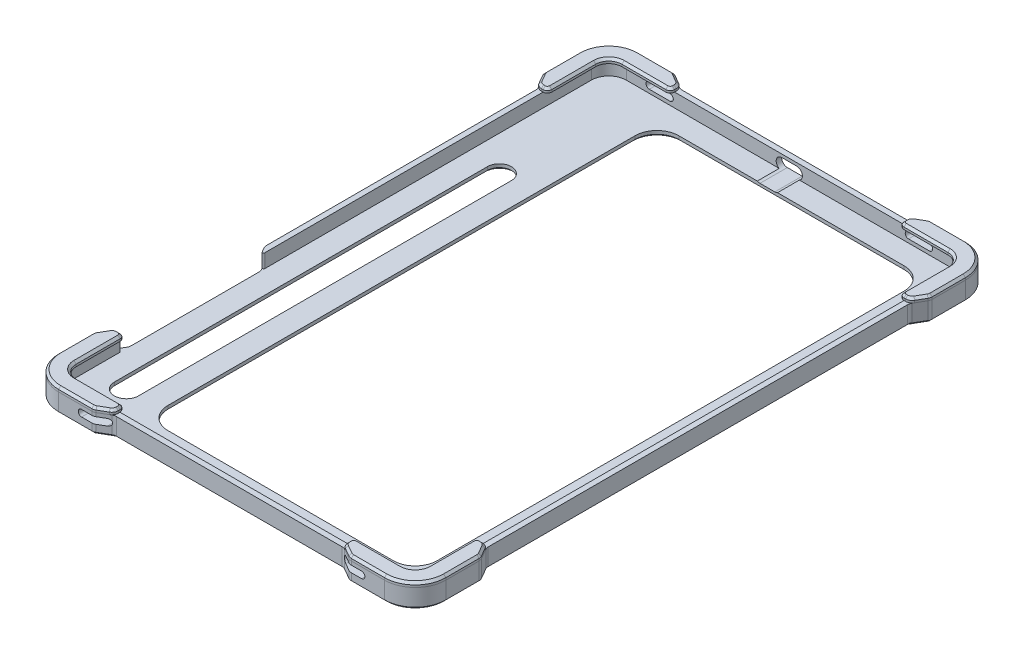
from build123d import *

# Parameters (mm, degrees)
BOSS_EXTRUDE1_DEPTH     = 8.8
SKETCH2_W               = 123
SKETCH2_H               = 233.5
BOSS_EXTRUDE2_DEPTH     = 2.5
FILLET1_R               = 10
CUT_EXTRUDE1_DEPTH      = 2.5
MIRROR2_COPY_1_DEPTH    = 2.5
BOSS_EXTRUDE3_DEPTH     = 2
BOSS_EXTRUDE4_DEPTH     = 2.4
MOVE_START              = 6.4
MOVE_FACE1_DEPTH        = 2.4
FILLET2_R               = 2
FILLET5_R               = 3
CHAMFER2_SIZE           = 1
CHAMFER3_SIZE           = 1
FILLET3_R               = 3
CUT_EXTRUDE2_DEPTH      = 277.754205027
CUT_EXTRUDE2_DEPTH_BACK = 277.754205027
CUT_EXTRUDE4_START      = -12.5
CUT_EXTRUDE4_DEPTH      = 12.5
CUT_EXTRUDE5_DEPTH      = 6.3


# Read off the part's stored shape, not the designer's step: Move Face1
with BuildPart() as part:
    # Sketch1 → Boss-Extrude1 (new body)
    with BuildSketch(Plane(origin=(0, 0, 0), x_dir=(1, 0, 0), z_dir=(0, 1, 0))):
        with BuildLine():
            ThreePointArc((-82.5, 118.75), (-80.156854249, 124.406854249), (-74.5, 126.75))
            Line((-74.5, 126.75), (74.5, 126.75))
            ThreePointArc((74.5, 126.75), (80.156854249, 124.406854249), (82.5, 118.75))
            Line((82.5, 118.75), (82.5, -118.75))
            ThreePointArc((82.5, -118.75), (80.156854249, -124.406854249), (74.5, -126.75))
            Line((74.5, -126.75), (-74.5, -126.75))
            ThreePointArc((-74.5, -126.75), (-80.156854249, -124.406854249), (-82.5, -118.75))
            Line((-82.5, -118.75), (-82.5, -92.357695155))
            Line((-82.5, -92.357695155), (-88.5, -102.75))
            Line((-88.5, -102.75), (-88.5, -118.75))
            ThreePointArc((-88.5, -118.75), (-84.399494937, -128.649494937), (-74.5, -132.75))
            Line((-74.5, -132.75), (-58.5, -132.75))
            Line((-58.5, -132.75), (-52.437822174, -129.25))
            Line((-52.437822174, -129.25), (52.437822174, -129.25))
            Line((52.437822174, -129.25), (58.5, -132.75))
            Line((58.5, -132.75), (74.5, -132.75))
            ThreePointArc((74.5, -132.75), (84.399494937, -128.649494937), (88.5, -118.75))
            Line((88.5, -118.75), (88.5, -102.75))
            Line((88.5, -102.75), (85, -96.687822174))
            Line((85, -96.687822174), (85, 96.687822174))
            Line((85, 96.687822174), (88.5, 102.75))
            Line((88.5, 102.75), (88.5, 118.75))
            ThreePointArc((88.5, 118.75), (84.399494937, 128.649494937), (74.5, 132.75))
            Line((74.5, 132.75), (58.5, 132.75))
            Line((58.5, 132.75), (52.437822174, 129.25))
            Line((52.437822174, 129.25), (-52.437822174, 129.25))
            Line((-52.437822174, 129.25), (-58.5, 132.75))
            Line((-58.5, 132.75), (-74.5, 132.75))
            ThreePointArc((-74.5, 132.75), (-84.399494937, 128.649494937), (-88.5, 118.75))
            Line((-88.5, 118.75), (-88.5, 102.75))
            Line((-88.5, 102.75), (-85, 96.687822174))
            Line((-85, 96.687822174), (-85, -28.027568136))
            Line((-85, -28.027568136), (-82.5, -32.357695155))
            Line((-82.5, -32.357695155), (-82.5, 118.75))
        make_face()
    extrude(amount=BOSS_EXTRUDE1_DEPTH)

    # Sketch2 → Boss-Extrude2 (add)
    with BuildSketch(Plane.XZ):
        with BuildLine():
            Line((-82.5, 118.75), (-82.5, -118.75))
            ThreePointArc((-82.5, -118.75), (-80.156854249, -124.406854249), (-74.5, -126.75))
            Line((-74.5, -126.75), (74.5, -126.75))
            ThreePointArc((74.5, -126.75), (80.156854249, -124.406854249), (82.5, -118.75))
            Line((82.5, -118.75), (82.5, 118.75))
            ThreePointArc((82.5, 118.75), (80.156854249, 124.406854249), (74.5, 126.75))
            Line((74.5, 126.75), (-74.5, 126.75))
            ThreePointArc((-74.5, 126.75), (-80.156854249, 124.406854249), (-82.5, 118.75))
        make_face()
        with BuildLine():
            ThreePointArc((-72, 109.75), (-66.5, 115.25), (-61, 109.75))
            Line((-61, 109.75), (-61, -60.75))
            ThreePointArc((-61, -60.75), (-66.5, -66.25), (-72, -60.75))
            Line((-72, -60.75), (-72, 109.75))
        make_face(mode=Mode.SUBTRACT)
        with Locations((11, 0)):
            Rectangle(SKETCH2_W, SKETCH2_H, mode=Mode.SUBTRACT)
    extrude(amount=-BOSS_EXTRUDE2_DEPTH)

    # Fillet1
    fillet1_edges = [part.edges().sort_by_distance(p)[0] for p in [
        (-50.5, 1.25, -116.75),
        (72.5, 1.25, -116.75),
        (72.5, 1.25, 116.75),
        (-50.5, 1.25, 116.75),
    ]]
    fillet(fillet1_edges, radius=FILLET1_R)

    # Sketch3 → Cut-Extrude1 (cut)
    with BuildSketch(Plane(origin=(0, 8.8, 0), x_dir=(1, 0, 0), z_dir=(0, 1, 0))):
        with BuildLine():
            ThreePointArc((-84, 104.25), (-85.5, 102.75), (-87, 104.25))
            Line((-87, 104.25), (-87, 118.75))
            ThreePointArc((-87, 118.75), (-83.338834765, 127.588834765), (-74.5, 131.25))
            Line((-74.5, 131.25), (-60, 131.25))
            ThreePointArc((-60, 131.25), (-58.5, 129.75), (-60, 128.25))
            Line((-60, 128.25), (-74.5, 128.25))
            ThreePointArc((-74.5, 128.25), (-81.217514421, 125.467514421), (-84, 118.75))
            Line((-84, 118.75), (-84, 104.25))
        make_face()
    cut_extrude1 = extrude(amount=-CUT_EXTRUDE1_DEPTH, mode=Mode.SUBTRACT)

    # Mirror1: Cut-Extrude1 across plane
    add(cut_extrude1.mirror(Plane(origin=(0, 0, 0), x_dir=(0, 0, 1), z_dir=(1, 0, 0))), mode=Mode.SUBTRACT)

    # Mirror2: Cut-Extrude1 across plane
    add(cut_extrude1.mirror(Plane.XY), mode=Mode.SUBTRACT)

    # Mirror2 copy 1 sketch → Mirror2 copy 1 (cut)
    with BuildSketch(Plane(origin=(0, 8.8, 0), x_dir=(-1, 0, 0), z_dir=(0, 1, 0))):
        with BuildLine():
            ThreePointArc((-84, 104.25), (-85.5, 102.75), (-87, 104.25))
            Line((-87, 104.25), (-87, 118.75))
            ThreePointArc((-87, 118.75), (-83.338834765, 127.588834765), (-74.5, 131.25))
            Line((-74.5, 131.25), (-60, 131.25))
            ThreePointArc((-60, 131.25), (-58.5, 129.75), (-60, 128.25))
            Line((-60, 128.25), (-74.5, 128.25))
            ThreePointArc((-74.5, 128.25), (-81.217514421, 125.467514421), (-84, 118.75))
            Line((-84, 118.75), (-84, 104.25))
        make_face()
    extrude(amount=-MIRROR2_COPY_1_DEPTH, mode=Mode.SUBTRACT)

    # Chamfer3
    chamfer3_edges = [part.edges().sort_by_distance(p)[0] for p in [
        (-82.5, 0, 62.357695155),
        (-66.5, 0, -66.25),
        (-66.5, 0, 115.25),
        (-72, 0, 24.5),
        (-61, 0, 24.5),
        (72.5, 0, 0),
        (11, 0, -116.75),
        (11, 0, 116.75),
        (-50.5, 0, 0),
        (69.571067812, 0, -113.821067812),
        (69.571067812, 0, 113.821067812),
        (-47.571067812, 0, -113.821067812),
        (-47.571067812, 0, 113.821067812),
        (55.468911087, 0, -131),
        (66.5, 0, -132.75),
        (84.399494937, 0, -128.649494937),
        (88.5, 0, -110.75),
        (86.75, 0, -99.718911087),
        (85, 0, 0),
        (86.75, 0, 99.718911087),
        (88.5, 0, 110.75),
        (84.399494937, 0, 128.649494937),
        (66.5, 0, 132.75),
        (55.468911087, 0, 131),
        (0, 0, 129.25),
        (-55.468911087, 0, 131),
        (-66.5, 0, 132.75),
        (-84.399494937, 0, 128.649494937),
        (-88.5, 0, 110.75),
        (-85.5, 0, 97.553847577),
        (-83.75, 0, 30.192631645),
        (-85, 0, -34.330127019),
        (-86.75, 0, -99.718911087),
        (-88.5, 0, -110.75),
        (-84.399494937, 0, -128.649494937),
        (-66.5, 0, -132.75),
        (-55.468911087, 0, -131),
        (0, 0, -129.25),
    ]]
    chamfer(chamfer3_edges, length=CHAMFER3_SIZE)

    # Fillet3
    fillet3_edges = [part.edges().sort_by_distance(p)[0] for p in [
        (-82.5, 1.75, 92.357695155),
        (-82.5, 1.75, 32.357695155),
        (52.437822174, 4.9, -129.25),
        (58.5, 4.9, -132.75),
        (88.5, 4.9, -102.75),
        (85, 4.9, -96.687822174),
        (85, 4.9, 96.687822174),
        (88.5, 4.9, 102.75),
        (58.5, 4.9, 132.75),
        (52.437822174, 4.9, 129.25),
        (-52.437822174, 4.9, 129.25),
        (-58.5, 4.9, 132.75),
        (-88.5, 4.9, 102.75),
        (-85, 4.9, 28.027568136),
        (-85, 4.9, -96.687822174),
        (-88.5, 4.9, -102.75),
        (-58.5, 4.9, -132.75),
        (-52.437822174, 4.9, -129.25),
    ]]
    fillet(fillet3_edges, radius=FILLET3_R)


with BuildPart() as body_2:
    # Sketch3<4> → Boss-Extrude3 (new body)
    # profile 1 of 2: a face of its own
    with BuildSketch(Plane(origin=(0, 8.8, 0), x_dir=(1, 0, 0), z_dir=(0, 1, 0))):
        with BuildLine():
            ThreePointArc((-74.5, 132.75), (-84.399494937, 128.649494937), (-88.5, 118.75))
            Line((-88.5, 118.75), (-88.5, 102.75))
            Line((-88.5, 102.75), (-85, 96.687822174))
            Line((-85, 96.687822174), (-80.5, 96.687822174))
            Line((-80.5, 96.687822174), (-80.5, 118.75))
            ThreePointArc((-80.5, 118.75), (-78.742640687, 122.992640687), (-74.5, 124.75))
            Line((-74.5, 124.75), (-52.437822174, 124.75))
            Line((-52.437822174, 124.75), (-52.437822174, 126.75))
            Line((-52.437822174, 126.75), (-52.437822174, 129.25))
            Line((-52.437822174, 129.25), (-58.5, 132.75))
            Line((-58.5, 132.75), (-74.5, 132.75))
        make_face()
        with BuildLine():
            Line((-74.5, 131.25), (-60, 131.25))
            ThreePointArc((-60, 131.25), (-58.5, 129.75), (-60, 128.25))
            Line((-60, 128.25), (-74.5, 128.25))
            ThreePointArc((-74.5, 128.25), (-81.217514421, 125.467514421), (-84, 118.75))
            Line((-84, 118.75), (-84, 104.25))
            ThreePointArc((-84, 104.25), (-85.5, 102.75), (-87, 104.25))
            Line((-87, 104.25), (-87, 118.75))
            ThreePointArc((-87, 118.75), (-83.338834765, 127.588834765), (-74.5, 131.25))
        make_face(mode=Mode.SUBTRACT)
    # profile 2 of 2: a face of its own
    with BuildSketch(Plane(origin=(0, 8.8, 0), x_dir=(1, 0, 0), z_dir=(0, 1, 0))):
        with BuildLine():
            ThreePointArc((-84, 104.25), (-85.5, 102.75), (-87, 104.25))
            Line((-87, 104.25), (-87, 118.75))
            ThreePointArc((-87, 118.75), (-83.338834765, 127.588834765), (-74.5, 131.25))
            Line((-74.5, 131.25), (-60, 131.25))
            ThreePointArc((-60, 131.25), (-58.5, 129.75), (-60, 128.25))
            Line((-60, 128.25), (-74.5, 128.25))
            ThreePointArc((-74.5, 128.25), (-81.217514421, 125.467514421), (-84, 118.75))
            Line((-84, 118.75), (-84, 104.25))
        make_face()
    extrude(amount=BOSS_EXTRUDE3_DEPTH)

    # Sketch3<5> → Boss-Extrude4 (add)
    with BuildSketch(Plane(origin=(0, 8.8, 0), x_dir=(1, 0, 0), z_dir=(0, 1, 0))):
        with BuildLine():
            Line((-60, 131.25), (-74.5, 131.25))
            ThreePointArc((-74.5, 131.25), (-83.338834765, 127.588834765), (-87, 118.75))
            Line((-87, 118.75), (-87, 104.25))
            ThreePointArc((-87, 104.25), (-85.5, 102.75), (-84, 104.25))
            Line((-84, 104.25), (-84, 118.75))
            ThreePointArc((-84, 118.75), (-81.217514421, 125.467514421), (-74.5, 128.25))
            Line((-74.5, 128.25), (-60, 128.25))
            ThreePointArc((-60, 128.25), (-58.5, 129.75), (-60, 131.25))
        make_face()
    extrude(amount=-BOSS_EXTRUDE4_DEPTH)

    # Move Face1 outline → Move Face1 (cut)
    with BuildSketch(Plane(origin=(0, 0, 0), x_dir=(1, 0, 0), z_dir=(0, 1, 0)).offset(MOVE_START)):
        with BuildLine():
            Line((-87, 118.75), (-87, 104.25))
            ThreePointArc((-87, 104.25), (-85.5, 102.75), (-84, 104.25))
            Line((-84, 104.25), (-84, 118.75))
            ThreePointArc((-84, 118.75), (-81.217514421, 125.467514421), (-74.5, 128.25))
            Line((-74.5, 128.25), (-60, 128.25))
            ThreePointArc((-60, 128.25), (-58.5, 129.75), (-60, 131.25))
            Line((-60, 131.25), (-74.5, 131.25))
            ThreePointArc((-74.5, 131.25), (-83.338834765, 127.588834765), (-87, 118.75))
        make_face()
        with BuildLine():
            ThreePointArc((-84.1, 104.25), (-85.5, 102.85), (-86.9, 104.25))
            Line((-86.9, 104.25), (-86.9, 118.75))
            ThreePointArc((-86.9, 118.75), (-83.268124087, 127.518124087), (-74.5, 131.15))
            Line((-74.5, 131.15), (-60, 131.15))
            ThreePointArc((-60, 131.15), (-58.6, 129.75), (-60, 128.35))
            Line((-60, 128.35), (-74.5, 128.35))
            ThreePointArc((-74.5, 128.35), (-81.288225099, 125.538225099), (-84.1, 118.75))
            Line((-84.1, 118.75), (-84.1, 104.25))
        make_face(mode=Mode.SUBTRACT)
    extrude(amount=MOVE_FACE1_DEPTH, mode=Mode.SUBTRACT)

    # Fillet2
    fillet2_edges = [body_2.edges().sort_by_distance(p)[0] for p in [
        (-52.437822174, 9.8, -124.75),
        (-80.5, 9.8, -96.687822174),
    ]]
    fillet(fillet2_edges, radius=FILLET2_R)

    # Fillet5
    fillet5_edges = [body_2.edges().sort_by_distance(p)[0] for p in [
        (-85, 9.8, -96.687822174),
        (-88.5, 9.8, -102.75),
        (-58.5, 9.8, -132.75),
        (-52.437822174, 9.8, -129.25),
    ]]
    fillet(fillet5_edges, radius=FILLET5_R)

    # Chamfer2
    chamfer2_edges = [body_2.edges().sort_by_distance(p)[0] for p in [
        (-84.399494937, 10.8, -128.649494937),
        (-88.5, 10.8, -111.151923789),
        (-78.742640687, 10.8, -122.992640687),
        (-64.468911087, 10.8, -124.75),
        (-80.5, 10.8, -108.718911087),
        (-81.085786438, 10.8, -97.273608611),
        (-53.023608611, 10.8, -125.335786438),
        (-66.901923789, 10.8, -132.75),
        (-55.870834875, 10.8, -131.232050808),
        (-52.437822174, 10.8, -127.133974596),
        (-86.982050808, 10.8, -100.120834875),
        (-82.883974596, 10.8, -96.687822174),
        (-84.767949192, 10.8, -97.089745962),
        (-88.397777479, 10.8, -102.777390442),
        (-52.839745962, 10.8, -129.017949192),
        (-58.527390442, 10.8, -132.647777479),
    ]]
    chamfer(chamfer2_edges, length=CHAMFER2_SIZE)


with BuildPart() as body_3:
    # Mirror3: mirrored copy
    add(body_2.part.mirror(Plane(origin=(0, 0, 0), x_dir=(0, 0, 1), z_dir=(1, 0, 0))))


with BuildPart() as body_4:
    # Mirror4: mirrored copy
    add(body_2.part.mirror(Plane.XY))


with BuildPart() as body_5:
    # Mirror4 2: mirrored copy
    add(body_3.part.mirror(Plane.XY))


with BuildPart() as cut_extrude2_tool:
    # Sketch4 → Cut-Extrude2 (new, two sides: drawn at the far end of the back side and taken through both)
    with BuildSketch(Plane(origin=(0, 0, -129.25), x_dir=(-1, 0, 0), z_dir=(0, 0, -1)).offset(-CUT_EXTRUDE2_DEPTH_BACK)):
        with BuildLine():
            Line((-64, 7.15), (-54.5, 7.15))
            ThreePointArc((-54.5, 7.15), (-53, 5.65), (-54.5, 4.15))
            Line((-54.5, 4.15), (-64, 4.15))
            ThreePointArc((-64, 4.15), (-65.5, 5.65), (-64, 7.15))
        make_face()
        with BuildLine():
            Line((64, 7.15), (54.5, 7.15))
            ThreePointArc((54.5, 7.15), (53, 5.65), (54.5, 4.15))
            Line((54.5, 4.15), (64, 4.15))
            ThreePointArc((64, 4.15), (65.5, 5.65), (64, 7.15))
        make_face()
    extrude(amount=CUT_EXTRUDE2_DEPTH + CUT_EXTRUDE2_DEPTH_BACK)


with BuildPart() as part_1:
    add(part.part)

    # Cut-Extrude2: cut by cut_extrude2_tool
    add(cut_extrude2_tool.part, mode=Mode.SUBTRACT)

    # Sketch4<3> → Cut-Extrude4 (cut)
    with BuildSketch(Plane(origin=(0, 0, -129.25), x_dir=(-1, 0, 0), z_dir=(0, 0, -1)).offset(CUT_EXTRUDE4_START)):
        with BuildLine():
            Line((-3.4, 7.4), (3.4, 7.4))
            ThreePointArc((3.4, 7.4), (6, 4.8), (3.4, 2.2))
            Line((3.4, 2.2), (-3.4, 2.2))
            ThreePointArc((-3.4, 2.2), (-6, 4.8), (-3.4, 7.4))
        make_face()
    extrude(amount=CUT_EXTRUDE4_DEPTH, mode=Mode.SUBTRACT)

    # Sketch6 → Cut-Extrude5 (cut)
    with BuildSketch(Plane(origin=(0, 8.8, 0), x_dir=(1, 0, 0), z_dir=(0, 1, 0))):
        with BuildLine():
            ThreePointArc((-83.433012702, -30.741669751), (-82.870590477, -30.974632664), (-82.5, -30.491669751))
            Line((-82.5, -30.491669751), (-79.98738142, -34.290843667))
            Line((-79.98738142, -34.290843667), (-84.901923789, -34.85323474))
            Line((-84.901923789, -34.85323474), (-83.433012702, -30.741669751))
        make_face()
        with BuildLine():
            Line((-83.267949192, -96.687822174), (-82.5, -96.687822174))
            Line((-82.5, -96.687822174), (-82.5, -92.357695155))
            Line((-82.5, -92.357695155), (-85.866025404, -98.187822174))
            ThreePointArc((-85.866025404, -98.187822174), (-84.767949192, -97.089745962), (-83.267949192, -96.687822174))
        make_face()
    extrude(amount=-CUT_EXTRUDE5_DEPTH, mode=Mode.SUBTRACT)


with BuildPart() as body_2_1:
    add(body_2.part)

    # Cut-Extrude2: cut by cut_extrude2_tool
    add(cut_extrude2_tool.part, mode=Mode.SUBTRACT)


with BuildPart() as body_3_1:
    add(body_3.part)

    # Cut-Extrude2: cut by cut_extrude2_tool
    add(cut_extrude2_tool.part, mode=Mode.SUBTRACT)


with BuildPart() as body_4_1:
    add(body_4.part)

    # Cut-Extrude2: cut by cut_extrude2_tool
    add(cut_extrude2_tool.part, mode=Mode.SUBTRACT)


with BuildPart() as body_5_1:
    add(body_5.part)

    # Cut-Extrude2: cut by cut_extrude2_tool
    add(cut_extrude2_tool.part, mode=Mode.SUBTRACT)


solid = Compound([part_1.part, body_2_1.part, body_3_1.part, body_4_1.part, body_5_1.part])
